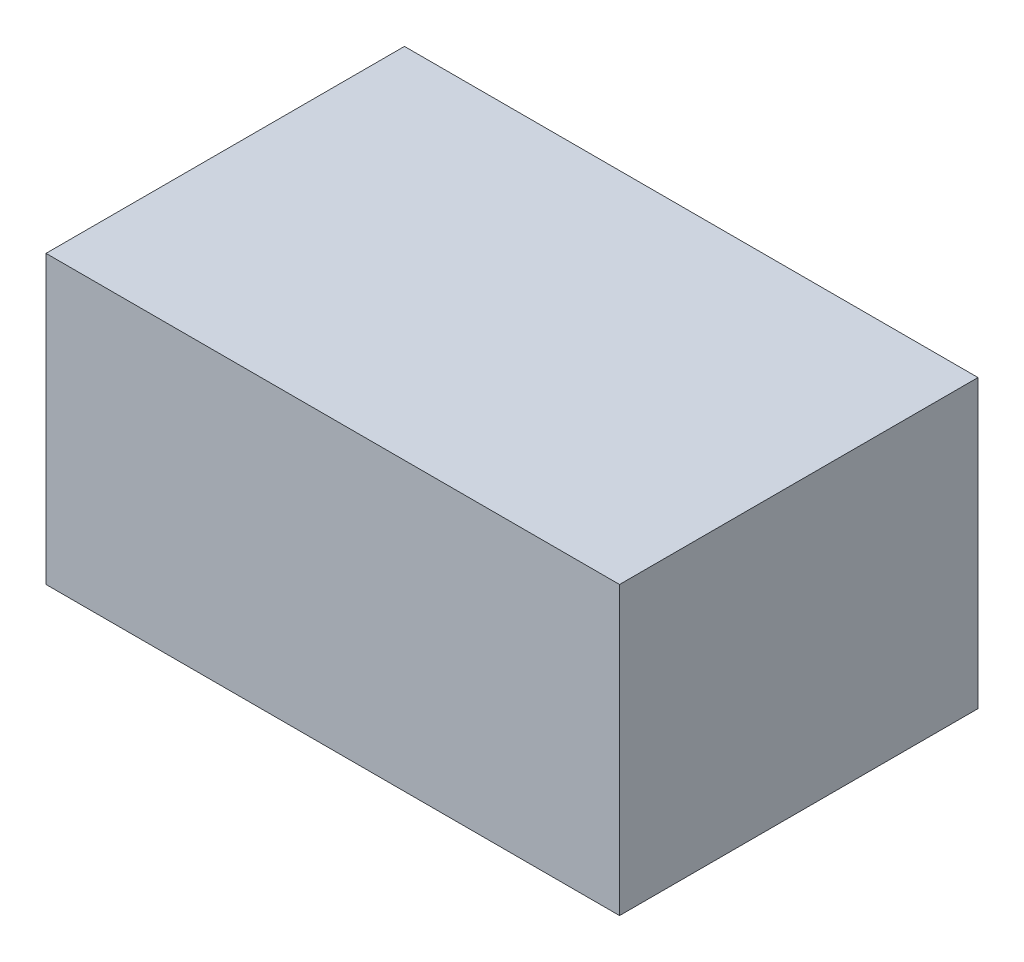
from build123d import *

# Parameters (mm, degrees)
SKETCH2_W           = 80
SKETCH2_H           = 50
BOSS_EXTRUDE1_DEPTH = 40
SKETCH3_W           = 68
SKETCH3_H           = 38
CUT_EXTRUDE1_DEPTH  = 6
DRAFT1_START        = -34
DRAFT1_DEPTH        = 68
DRAFT1_START_2      = -20
DRAFT1_2_DEPTH      = 40


with BuildPart() as part:
    # Sketch2 → Boss-Extrude1 (new body)
    with BuildSketch(Plane(origin=(0, 0, 0), x_dir=(1, 0, 0), z_dir=(0, 1, 0))):
        Rectangle(SKETCH2_W, SKETCH2_H)
    extrude(amount=BOSS_EXTRUDE1_DEPTH)

    # Sketch3 → Cut-Extrude1 (cut)
    with BuildSketch(Plane.XZ):
        Rectangle(SKETCH3_W, SKETCH3_H)
    extrude(amount=-CUT_EXTRUDE1_DEPTH, mode=Mode.SUBTRACT)

    # Draft1: read off the stored shape, not the designer's step
    # Draft1 outline → Draft1 (add)
    with BuildSketch(Plane.YZ.offset(DRAFT1_START)):
        Polygon((6, 19), (0, 19), (6, 15.535898385), align=None)
        Polygon((6, -19), (6, -15.535898385), (0, -19), align=None)
    extrude(amount=DRAFT1_DEPTH)

    # Draft1 2 outline → Draft1 2 (add)
    with BuildSketch(Plane.XY.offset(DRAFT1_START_2)):
        Polygon((34, 6), (30.535898385, 6), (34, 0), align=None)
        Polygon((-34, 0), (-30.535898385, 6), (-34, 6), align=None)
    extrude(amount=DRAFT1_2_DEPTH)


solid = part.part
